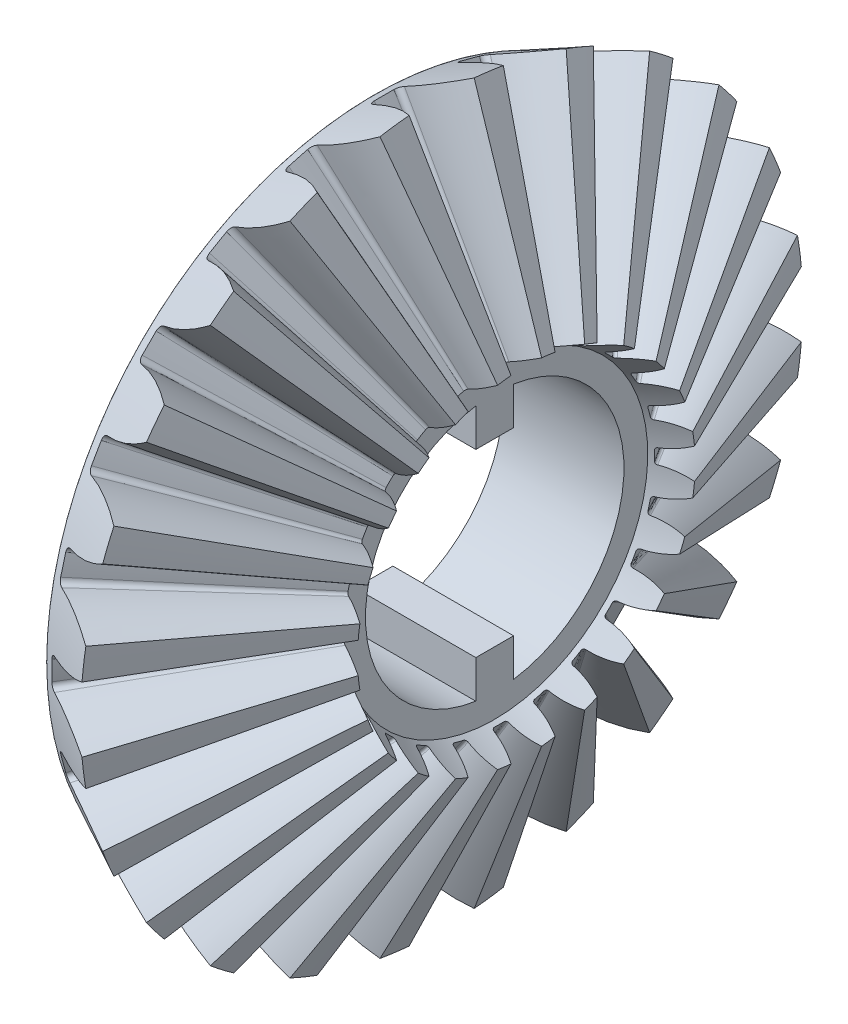
from build123d import *

# Parameters (mm, degrees)
TEETHCUTS_COUNT    = 24
TEETHCUTS_ANGLE    = 345
HUBSKE_R           = 7.799559846
HUB_DEPTH          = 0.000762
CUT_EXTRUDE1_DEPTH = 10


with BuildPart() as part:
    # BasProSke → Base-Revolve (revolve)
    with BuildSketch(Plane(origin=(0, 0, 0), x_dir=(1, 0, 0), z_dir=(0, 1, 0)), mode=Mode.PRIVATE) as base_revolve_sk:
        Polygon((0, 0), (0, 7.799559848), (1.610975175, 8.605047433), (3.628709814, 4.023744809), (2.875413211, 3.647096508), (2.875413211, 0), align=None)
    revolve(base_revolve_sk.sketch.rotate(Axis((-10, 0, 0), (1, 0, 0)), 180), axis=Axis((-10, 0, 0), (1, 0, 0)))

    # ToothCut: read off the stored shape, not the designer's step
    # ToothCut: loft between two sections, ruled curve by curve
    toothcut_from = [
        Edge.make_bspline([(5.409710776, 0.004415234, -0.007988636), (5.404714317, 0.001917004, -0.014892369), (5.396771579, -0.002054364, -0.014800518), (5.391903913, -0.004488198, -0.007782714)], [0, 0, 0, 0, 1, 1, 1, 1], 3, [1, 0.74730168, 0.74730168, 1]),
        Edge.make_bspline([(5.391903913, -0.004488198, 0.007782714), (5.396771579, -0.002054364, 0.014800518), (5.404714317, 0.001917004, 0.014892369), (5.409710776, 0.004415234, 0.007988636)], [0, 0, 0, 0, 1, 1, 1, 1], 3, [1, 0.74730168, 0.74730168, 1]),
        Edge.make_bspline([(5.391903913, -0.004488198, -0.007782714), (5.391232827, -0.004823741, -0.006815198), (5.390692972, -0.005093668, -0.00574996), (5.390295541, -0.005292383, -0.004609086)], [0, 0, 0, 0, 1, 1, 1, 1], 3, [1, 0.993089667, 0.993089667, 1]),
        Edge.make_bspline([(5.390295541, -0.005292383, 0.004609086), (5.390692972, -0.005093668, 0.00574996), (5.391232827, -0.004823741, 0.006815198), (5.391903913, -0.004488198, 0.007782714)], [0, 0, 0, 0, 1, 1, 1, 1], 3, [1, 0.993089667, 0.993089667, 1]),
        Edge.make_bspline([(5.390295541, -0.005292383, -0.004609086), (5.389250623, -0.005814843, -0.00160952), (5.389250623, -0.005814843, 0.00160952), (5.390295541, -0.005292383, 0.004609086)], [0, 0, 0, 0, 1, 1, 1, 1], 3, [1, 0.954546834, 0.954546834, 1]),
        Edge.make_line((5.409710776, 0.004415234, 0.007988636), (5.409710776, 0.004415234, -0.007988636)),
    ]
    toothcut_to = [
        Edge.make_bspline([(1.73231388, 8.665716785, -0.865103415), (1.3117445, 8.455432096, -0.574902334), (0.84089319, 8.220006441, -0.407007345), (0.34770294, 7.973411317, -0.37138229)], [0, 0, 0, 0, 1, 1, 1, 1], 3, [1, 0.980218108, 0.980218108, 1]),
        Edge.make_bspline([(0.34770294, 7.973411317, 0.37138229), (0.84089319, 8.220006441, 0.407007345), (1.3117445, 8.455432096, 0.574902334), (1.73231388, 8.665716785, 0.865103415)], [0, 0, 0, 0, 1, 1, 1, 1], 3, [1, 0.980218108, 0.980218108, 1]),
        Edge.make_bspline([(0.34770294, 7.973411317, -0.37138229), (0.280144036, 7.939631866, -0.366502247), (0.234639562, 7.916879629, -0.310459851), (0.23680946, 7.917964577, -0.234808109)], [0, 0, 0, 0, 1, 1, 1, 1], 3, [1, 0.812326566, 0.812326566, 1]),
        Edge.make_bspline([(0.23680946, 7.917964577, 0.234808109), (0.234639562, 7.916879629, 0.310459851), (0.280144036, 7.939631866, 0.366502247), (0.34770294, 7.973411317, 0.37138229)], [0, 0, 0, 0, 1, 1, 1, 1], 3, [1, 0.812326566, 0.812326566, 1]),
        Edge.make_bspline([(0.23680946, 7.917964577, -0.234808109), (0.241298647, 7.920209171, -0.078296188), (0.241298647, 7.920209171, 0.078296188), (0.23680946, 7.917964577, 0.234808109)], [0, 0, 0, 0, 1, 1, 1, 1], 3, [1, 0.999657473, 0.999657473, 1]),
        Edge.make_line((1.73231388, 8.665716785, 0.865103415), (1.73231388, 8.665716785, -0.865103415)),
    ]
    toothcut = Solid(Shell([*[Face.make_surface_from_curves(toothcut_from[k], toothcut_to[k]) for k in range(6)], Face(Wire(toothcut_from)), Face(Wire(toothcut_to))]))
    add(toothcut, mode=Mode.SUBTRACT)

    # TeethCuts: ToothCut ×24 about axis
    teethcuts_axis = Axis((-10, 0, 0), (1, 0, 0))
    for i in range(1, TEETHCUTS_COUNT):
        add(toothcut.rotate(teethcuts_axis, i * TEETHCUTS_ANGLE / (TEETHCUTS_COUNT - 1)), mode=Mode.SUBTRACT)

    # HubSke → Hub (add)
    with BuildSketch(Plane.ZY):
        Circle(HUBSKE_R)
    extrude(amount=HUB_DEPTH)

    # Sketch1 → Cut-Extrude1 (cut)
    with BuildSketch(Plane(origin=(2.875413211, 0, 0), x_dir=(0, 0, -1), z_dir=(1, 0, 0))):
        with BuildLine():
            Line((-0.45, 3.046949294), (-0.45, 2.146949294))
            Line((-0.45, 2.146949294), (0.45, 2.146949294))
            Line((0.45, 2.146949294), (0.45, 3.046949294))
            ThreePointArc((0.45, 3.046949294), (3.08, 0), (0.45, -3.046949294))
            Line((0.45, -3.046949294), (0.45, -2.146949294))
            Line((0.45, -2.146949294), (-0.45, -2.146949294))
            Line((-0.45, -2.146949294), (-0.45, -3.046949294))
            ThreePointArc((-0.45, -3.046949294), (-3.08, 0), (-0.45, 3.046949294))
        make_face()
    extrude(amount=-CUT_EXTRUDE1_DEPTH, mode=Mode.SUBTRACT)


solid = part.part
